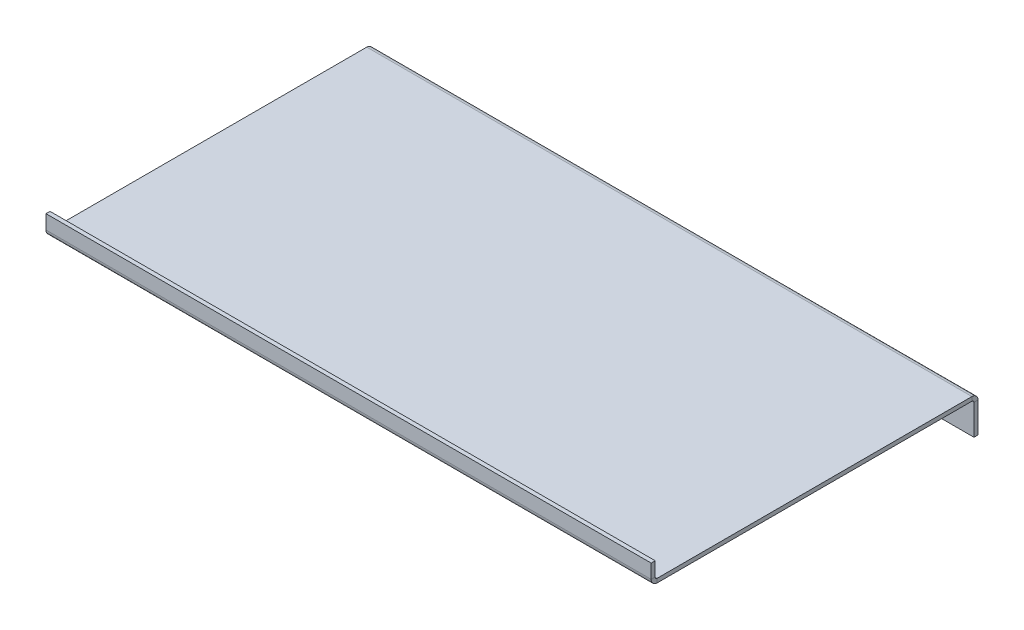
from build123d import *

# Parameters (mm, degrees)
BASE_FLANGE1_DEPTH = 150
SKETCH2_R          = 1.25
CUT_EXTRUDE1_DEPTH = 10


# Sheet-metal steps are written as plain solids
with BuildPart() as part:
    # Sketch1 → Base-Flange1 (new body)
    with BuildSketch(Plane(origin=(0, 0, 0), x_dir=(0, 0, -1), z_dir=(1, 0, 0))):
        with BuildLine():
            Line((0, 0), (0, 7.5))
            ThreePointArc((0, 7.5), (-0.146446609, 7.853553391), (-0.5, 8))
            Line((-0.5, 8), (-78.5, 8))
            ThreePointArc((-78.5, 8), (-79.560660172, 8.439339828), (-80, 9.5))
            Line((-80, 9.5), (-80, 13))
            Line((-80, 13), (-79, 13))
            Line((-79, 13), (-79, 9.5))
            ThreePointArc((-79, 9.5), (-78.853553391, 9.146446609), (-78.5, 9))
            Line((-78.5, 9), (-0.5, 9))
            ThreePointArc((-0.5, 9), (0.560660172, 8.560660172), (1, 7.5))
            Line((1, 7.5), (1, 0))
            Line((1, 0), (0, 0))
        make_face()
    extrude(amount=BASE_FLANGE1_DEPTH)

    # Sketch2 → Cut-Extrude1 (cut)
    with BuildSketch(Plane(origin=(0, 0, -1), x_dir=(-1, 0, 0), z_dir=(0, 0, -1))):
        with Locations((-25, 3.75)):
            Circle(SKETCH2_R)
        with Locations((-125, 3.75)):
            Circle(SKETCH2_R)
    extrude(amount=-CUT_EXTRUDE1_DEPTH, mode=Mode.SUBTRACT)


solid = part.part
